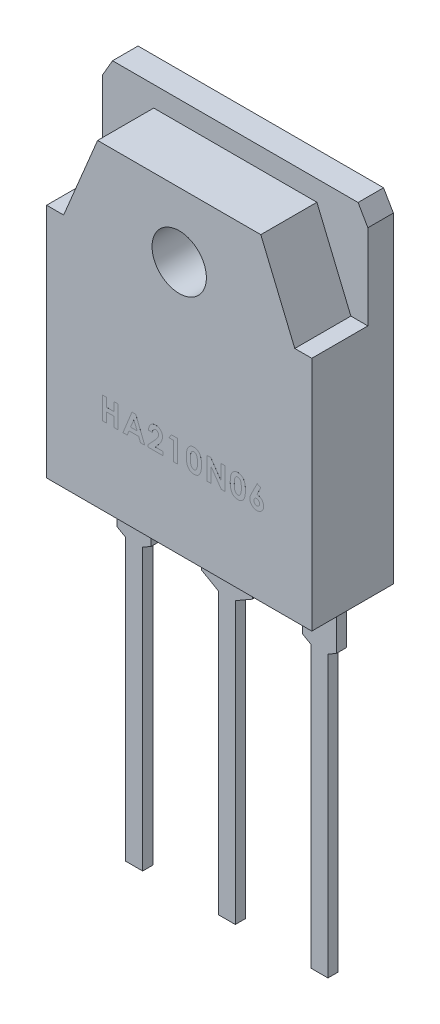
from build123d import *
from OCP.BRepFilletAPI import BRepFilletAPI_MakeChamfer

# Parameters (mm, degrees)
SKETCH1_W                  = 15.6
SKETCH1_H                  = 19.9
MAIN_BODY_DEPTH            = 1.5
FRONT_BODY_DEPTH           = 3.3
FRONT_BODY_DEPTH_BACK      = 1.5
SKETCH3_W                  = 15.6
SKETCH3_H                  = 13.9
SKETCH5_W                  = 2
SKETCH5_H                  = 0.6
LEG_BASE_DEPTH             = 3.5
SKETCH6_W                  = 1
SKETCH6_H                  = 0.6
BASE_DEPTH                 = 16.5
TOP_BODY_DEPTH             = 3.3
F_3_2_3_2_DIAMETER_HOLE1_D = 3.2
PN_DEPTH                   = 0.001
LPATTERN1_COUNT            = 2
LPATTERN1_PITCH            = 5.45
LPATTERN1_COL_COUNT        = 2
LPATTERN1_COL_PITCH        = 5.45
SKETCH14_W                 = 3
SKETCH14_H                 = 3.5
BOSS_EXTRUDE10_DEPTH       = 0.6
CHAMFER1_SIZE              = 0.288675135
CHAMFER1_SIZE_2            = 0.5
CHAMFER2_SIZE              = 0.577350269
CHAMFER2_SIZE_2            = 1
CHAMFER3_SIZE              = 1
CHAMFER3_SIZE2             = 0.577350269


with BuildPart() as part:
    # Sketch1 → MAIN BODY (new body)
    with BuildSketch(Plane.XY):
        with Locations((7.8, 9.95)):
            Rectangle(SKETCH1_W, SKETCH1_H)
    extrude(amount=MAIN_BODY_DEPTH)

    # Sketch3 → FRONT BODY (add, two sides: drawn at the far end of the back side and taken through both)
    with BuildSketch(Plane.XY.offset(1.5).offset(-FRONT_BODY_DEPTH_BACK)):
        with Locations((7.8, 6.95)):
            Rectangle(SKETCH3_W, SKETCH3_H)
    extrude(amount=FRONT_BODY_DEPTH + FRONT_BODY_DEPTH_BACK)

    # Sketch5 → LEG BASE (add)
    with BuildSketch(Plane.XZ):
        with Locations((7.8, 1.7)):
            Rectangle(SKETCH5_W, SKETCH5_H)
    leg_base = extrude(amount=LEG_BASE_DEPTH)

    # Sketch6 → BASE (add)
    with BuildSketch(Plane.XZ.offset(3.5)):
        with Locations((7.8, 1.7)):
            Rectangle(SKETCH6_W, SKETCH6_H)
    base = extrude(amount=BASE_DEPTH)

    # Sketch11 → TOP BODY (add)
    with BuildSketch(Plane.XY.offset(1.5)):
        Polygon((1, 13.9), (3, 18.7), (12.6, 18.7), (14.6, 13.9), align=None)
    extrude(amount=TOP_BODY_DEPTH)

    # Ø3.2 (3.2) Diameter Hole1 (through all)
    with Locations(Plane.XY.offset(4.8)):
        with Locations((7.8, 14.9)):
            Hole(F_3_2_3_2_DIAMETER_HOLE1_D / 2)

    # Sketch10 → PN (add)
    # profile 1 of 8: a face of its own
    with BuildSketch(Plane.XY.offset(4.8)):
        Polygon((3.277142395, 5.873107542), (3.5130431, 5.873107542), (3.5130431, 5.367606031), (3.96799446, 5.367606031), (3.96799446, 5.873107542), (4.203895165, 5.873107542), (4.203895165, 4.558803614), (3.96799446, 4.558803614), (3.96799446, 5.131705326), (3.5130431, 5.131705326), (3.5130431, 4.558803614), (3.277142395, 4.558803614), align=None)
    # profile 2 of 8: a face of its own
    with BuildSketch(Plane.XY.offset(4.8)):
        Polygon((5.023070895, 5.873107542), (5.241858267, 5.873107542), (5.772634854, 4.558803614), (5.520673944, 4.558803614), (5.418520514, 4.82840442), (4.845882084, 4.82840442), (4.743728654, 4.558803614), (4.492031026, 4.558803614), align=None)
        Polygon((5.13233294, 5.520572895), (4.935397976, 5.064305125), (5.329267903, 5.064305125), align=None, mode=Mode.SUBTRACT)
    # profile 3 of 8: a face of its own
    with BuildSketch(Plane.XY.offset(4.8)):
        with BuildLine():
            Line((6.229271218, 5.435006233), (5.993370513, 5.435006233))
            add(Edge.make_bspline(
                [(5.993370513, 5.435006233), (5.994389332, 5.452850873), (5.996380043, 5.487718229), (6.004298589, 5.53836418), (6.014909168, 5.586219034), (6.029070395, 5.63111539), (6.046864903, 5.673036934), (6.067834793, 5.712126579), (6.0925158, 5.748178518), (6.120382629, 5.781018886), (6.150962178, 5.810480284), (6.183619587, 5.836602609), (6.218854395, 5.858158095), (6.256022831, 5.875896265), (6.295118569, 5.890068238), (6.336511513, 5.899543349), (6.379843263, 5.905959986), (6.409507355, 5.906521468), (6.42462649, 5.906807643)],
                knots=[0, 0, 0, 0, 1.199038563, 2.342849363, 3.436047546, 4.486744587, 5.497670872, 6.488682221, 7.459191391, 8.424610317, 9.374430501, 10.305433194, 11.225809216, 12.140057399, 13.06607119, 14.010487599, 14.985989317, 16, 16, 16, 16], degree=3))
            add(Edge.make_bspline(
                [(6.42462649, 5.906807643), (6.443185013, 5.906228568), (6.479415599, 5.905098078), (6.532061516, 5.895454625), (6.581227045, 5.879324459), (6.626876449, 5.856786363), (6.668621107, 5.828154075), (6.706454095, 5.794014758), (6.739231285, 5.75365215), (6.767160492, 5.708745675), (6.790366325, 5.661196037), (6.806628007, 5.61202774), (6.817316635, 5.562545511), (6.818456643, 5.529226683), (6.819022981, 5.512674434)],
                knots=[0, 0, 0, 0, 1.075374347, 2.099382735, 3.09057751, 4.06680945, 5.040638231, 6.016817125, 7.011024321, 8.044445721, 9.0776792, 10.070479129, 11.0414456, 12, 12, 12, 12], degree=3))
            add(Edge.make_bspline(
                [(6.819022981, 5.512674434), (6.818802479, 5.502662464), (6.818358663, 5.482510841), (6.815272752, 5.45201649), (6.810643276, 5.420954429), (6.803663155, 5.389351289), (6.794958371, 5.357198213), (6.78439821, 5.324398977), (6.771737718, 5.291139541), (6.757188174, 5.257045575), (6.739830531, 5.22200639), (6.719619969, 5.185496734), (6.696020053, 5.147548996), (6.66931584, 5.107948908), (6.639377635, 5.066758928), (6.60605929, 5.024103131), (6.569744552, 4.979831213), (6.543970961, 4.950237921), (6.53072915, 4.935033645)],
                knots=[0, 0, 0, 0, 0.728284026, 1.46585585, 2.227944881, 3.01186502, 3.81876927, 4.650621989, 5.517437689, 6.406905708, 7.346299482, 8.360816762, 9.441613733, 10.596154504, 11.834900912, 13.145207542, 14.533280747, 16, 16, 16, 16], degree=3))
            Line((6.53072915, 4.935033645), (6.393559209, 4.777854269))
            Line((6.393559209, 4.777854269), (6.835873031, 4.777854269))
            Line((6.835873031, 4.777854269), (6.835873031, 4.558803614))
            Line((6.835873031, 4.558803614), (5.959670412, 4.558803614))
            Line((5.959670412, 4.558803614), (5.959670412, 4.678333659))
            Line((5.959670412, 4.678333659), (6.348801263, 5.092476303))
            add(Edge.make_bspline(
                [(6.348801263, 5.092476303), (6.360067601, 5.104556972), (6.381887157, 5.127953647), (6.412934136, 5.162314152), (6.44102891, 5.194921451), (6.46558891, 5.226122747), (6.487903014, 5.254905995), (6.506976237, 5.282138759), (6.522983085, 5.307574846), (6.540360789, 5.338246323), (6.556863895, 5.374827518), (6.572006493, 5.416970555), (6.581236955, 5.457249593), (6.582511051, 5.483496279), (6.583122276, 5.496087665)],
                knots=[0, 0, 0, 0, 1.246127091, 2.413378631, 3.493388633, 4.492180848, 5.408488754, 6.240484944, 6.999099869, 7.674939598, 8.898438119, 10.020720584, 11.050475521, 12, 12, 12, 12], degree=3))
            add(Edge.make_bspline(
                [(6.583122276, 5.496087665), (6.582665278, 5.50826886), (6.58177977, 5.531871878), (6.572048764, 5.565447044), (6.556973152, 5.595845931), (6.535729485, 5.622160183), (6.509996752, 5.643784349), (6.48026016, 5.659867797), (6.446762153, 5.669147872), (6.423279411, 5.670309406), (6.411199106, 5.670906938)],
                knots=[0, 0, 0, 0, 1.062038974, 2.057870785, 3.028805853, 4.01125022, 4.991535629, 5.949134679, 6.94496649, 8, 8, 8, 8], degree=3))
            add(Edge.make_bspline(
                [(6.411199106, 5.670906938), (6.404958266, 5.670686202), (6.392672171, 5.670251649), (6.374612572, 5.667358947), (6.357427565, 5.662260861), (6.340925873, 5.655430144), (6.325283606, 5.646375979), (6.310540219, 5.635215279), (6.29654037, 5.622231661), (6.283348271, 5.607465724), (6.271341737, 5.590986934), (6.260677579, 5.572945792), (6.251860095, 5.553353495), (6.244096861, 5.532468692), (6.238109484, 5.510067063), (6.233749931, 5.486282679), (6.230435653, 5.461154235), (6.229666424, 5.443880793), (6.229271218, 5.435006233)],
                knots=[0, 0, 0, 0, 0.903469896, 1.778625579, 2.63899355, 3.493148037, 4.358286772, 5.247621495, 6.164656832, 7.118446693, 8.109501108, 9.111810964, 10.146451449, 11.215617525, 12.33435995, 13.498009769, 14.714554818, 16, 16, 16, 16], degree=3))
        make_face()
    # profile 4 of 8: a face of its own
    with BuildSketch(Plane.XY.offset(4.8)):
        Polygon((7.340690009, 5.873107542), (7.70533563, 5.873107542), (7.70533563, 4.558803614), (7.469434925, 4.558803614), (7.469434925, 5.654056887), (7.199834119, 5.654056887), align=None)
    # profile 5 of 8: a face of its own
    with BuildSketch(Plane.XY.offset(4.8)):
        with BuildLine():
            add(Edge.make_bspline(
                [(8.663524275, 5.906807643), (8.674942848, 5.906638131), (8.697394814, 5.906304825), (8.730462333, 5.902694852), (8.762315497, 5.89724119), (8.793078918, 5.889635233), (8.82253116, 5.87956902), (8.85088658, 5.867519935), (8.877807668, 5.852855979), (8.903637754, 5.836292289), (8.928366887, 5.817539842), (8.951400721, 5.796161086), (8.973159902, 5.772647944), (8.993173423, 5.746644941), (9.011884492, 5.718388602), (9.029231625, 5.687874447), (9.045082026, 5.654953128), (9.059613342, 5.619565237), (9.07260729, 5.581180324), (9.083552076, 5.539358098), (9.092939061, 5.494089008), (9.10086234, 5.445260373), (9.106851057, 5.392807287), (9.110887574, 5.336764598), (9.113657622, 5.277240348), (9.113883694, 5.236407201), (9.11399984, 5.215429014)],
                knots=[0, 0, 0, 0, 0.879237366, 1.728815576, 2.559023295, 3.367336655, 4.166867292, 4.954216142, 5.737608147, 6.525189134, 7.316157332, 8.124696809, 8.942788509, 9.781158001, 10.649253743, 11.551476218, 12.482711956, 13.461909668, 14.496590415, 15.601789533, 16.789733467, 18.056700938, 19.410929216, 20.8549011, 22.384193279, 24, 24, 24, 24], degree=3))
            add(Edge.make_bspline(
                [(9.11399984, 5.215429014), (9.113874318, 5.194188366), (9.113630431, 5.152918169), (9.111002725, 5.092849479), (9.106477692, 5.036399887), (9.100645502, 4.983575231), (9.092656997, 4.934403408), (9.083301347, 4.888757095), (9.0721838, 4.846652839), (9.058761836, 4.808185509), (9.044318479, 4.772735469), (9.02842472, 4.739878338), (9.011357584, 4.709525123), (8.993508541, 4.681217902), (8.973899039, 4.65579116), (8.953483529, 4.632380252), (8.931373083, 4.611876932), (8.908498637, 4.593224549), (8.884022206, 4.577105147), (8.85819621, 4.563007384), (8.830560216, 4.551572423), (8.801617981, 4.541626905), (8.770876179, 4.534487097), (8.738823293, 4.528821893), (8.705097452, 4.525690954), (8.682135541, 4.525302541), (8.670369607, 4.525103513)],
                knots=[0, 0, 0, 0, 1.643780988, 3.193836972, 4.651895693, 6.025988579, 7.305620092, 8.505800249, 9.631074763, 10.672816429, 11.65661981, 12.592235626, 13.49536222, 14.350718032, 15.179365177, 15.97804903, 16.751647189, 17.51006938, 18.259804725, 19.016521909, 19.783502495, 20.571750527, 21.382245291, 22.22305063, 23.089471752, 24, 24, 24, 24], degree=3))
            add(Edge.make_bspline(
                [(8.670369607, 4.525103513), (8.658603991, 4.52530638), (8.635555323, 4.525703792), (8.601738284, 4.528798613), (8.569515534, 4.534510047), (8.538530515, 4.54168172), (8.508998877, 4.551550418), (8.480779019, 4.563327504), (8.454087926, 4.577337304), (8.428851694, 4.593494263), (8.405156488, 4.612021847), (8.382634083, 4.632721884), (8.361334301, 4.655541904), (8.341581165, 4.68073751), (8.323051174, 4.707972393), (8.305937568, 4.737557563), (8.290250631, 4.769449944), (8.275499674, 4.803693991), (8.262682959, 4.841026939), (8.251276678, 4.881782167), (8.241932952, 4.926299402), (8.234418103, 4.974564344), (8.228418251, 5.026474741), (8.223955052, 5.082055648), (8.22131275, 5.141332954), (8.221071421, 5.182077199), (8.220947171, 5.203054758)],
                knots=[0, 0, 0, 0, 0.917216111, 1.796812873, 2.643793957, 3.46689424, 4.273913431, 5.068098542, 5.848489301, 6.620921603, 7.401012384, 8.190319798, 9.003608147, 9.831726257, 10.68377682, 11.569763213, 12.493818149, 13.453288342, 14.474581811, 15.568529029, 16.750744269, 18.018426408, 19.375425659, 20.823733699, 22.36466933, 24, 24, 24, 24], degree=3))
            add(Edge.make_bspline(
                [(8.220947171, 5.203054758), (8.221172239, 5.232201425), (8.22160651, 5.288440294), (8.227109922, 5.369689108), (8.235187534, 5.444789563), (8.247051632, 5.513616033), (8.261721426, 5.576423432), (8.28050686, 5.632798017), (8.301892711, 5.683519858), (8.320116204, 5.713567782), (8.328892806, 5.72803914)],
                knots=[0, 0, 0, 0, 1.288568992, 2.486310467, 3.599230591, 4.627010532, 5.572937695, 6.447898582, 7.252493626, 8, 8, 8, 8], degree=3))
            add(Edge.make_bspline(
                [(8.328892806, 5.72803914), (8.339097821, 5.742255797), (8.359050636, 5.770052163), (8.393938691, 5.806543596), (8.431421364, 5.837752856), (8.472268527, 5.86297365), (8.515834165, 5.882862771), (8.562492313, 5.896910233), (8.612070668, 5.905094938), (8.646116952, 5.906228216), (8.663524275, 5.906807643)],
                knots=[0, 0, 0, 0, 1.058512271, 2.069600068, 3.047294572, 4.004278952, 4.967380941, 5.939006123, 6.946246673, 8, 8, 8, 8], degree=3))
        make_face()
        with BuildLine():
            add(Edge.make_bspline(
                [(8.669316479, 5.670906938), (8.658993994, 5.670417672), (8.638756445, 5.669458453), (8.609390795, 5.661316032), (8.581700822, 5.648739623), (8.560637798, 5.633605881), (8.544872335, 5.619098375), (8.533856893, 5.605969554), (8.523234235, 5.591318735), (8.513851768, 5.574484804), (8.50499227, 5.556072622), (8.496333871, 5.53599861), (8.489236257, 5.513769706), (8.482263039, 5.489764472), (8.47615385, 5.463319227), (8.471035688, 5.434217809), (8.466463061, 5.40227097), (8.463273599, 5.367457785), (8.460300063, 5.329814676), (8.458168492, 5.289257789), (8.457277336, 5.245798067), (8.456994064, 5.215868001), (8.456847876, 5.200421938)],
                knots=[0, 0, 0, 0, 1.076674018, 2.110852608, 3.161083442, 4.239746716, 4.804137807, 5.395870207, 6.026861976, 6.692161227, 7.405688833, 8.16177676, 8.973626916, 9.841385931, 10.773283133, 11.807421078, 12.927755683, 14.143907515, 15.458935494, 16.872852025, 18.386167141, 20, 20, 20, 20], degree=3))
            add(Edge.make_bspline(
                [(8.456847876, 5.200421938), (8.457088484, 5.180410817), (8.457549869, 5.142038008), (8.459966385, 5.086856574), (8.464810092, 5.036637025), (8.470834685, 4.991039006), (8.479296472, 4.950358231), (8.489032305, 4.914209823), (8.501055194, 4.883054586), (8.514949959, 4.856441946), (8.530339037, 4.833802628), (8.547044558, 4.814559106), (8.56449776, 4.797895123), (8.583243412, 4.784359176), (8.603236794, 4.77398585), (8.624310998, 4.766524444), (8.646479415, 4.761957007), (8.661660119, 4.761323651), (8.669316479, 4.761004218)],
                knots=[0, 0, 0, 0, 1.771748488, 3.397459088, 4.888034009, 6.237357457, 7.467047327, 8.564189669, 9.548206622, 10.417051504, 11.216568818, 11.965764335, 12.669334354, 13.348544111, 14.005342236, 14.656555988, 15.322436492, 16, 16, 16, 16], degree=3))
            add(Edge.make_bspline(
                [(8.669316479, 4.761004218), (8.676710097, 4.761222798), (8.691185882, 4.761650749), (8.712294818, 4.766043609), (8.732256928, 4.773185446), (8.75101194, 4.783288075), (8.768626938, 4.796135114), (8.78501583, 4.811783018), (8.800055016, 4.83038776), (8.808816914, 4.84419523), (8.813331753, 4.851309957)],
                knots=[0, 0, 0, 0, 0.992283464, 1.942767638, 2.88273346, 3.832339453, 4.79467288, 5.803907806, 6.868395428, 8, 8, 8, 8], degree=3))
            add(Edge.make_bspline(
                [(8.813331753, 4.851309957), (8.818647217, 4.861032004), (8.829793312, 4.881418348), (8.842691592, 4.915819544), (8.853548646, 4.954618407), (8.862893153, 4.997935682), (8.869284226, 5.04594222), (8.87478821, 5.098333606), (8.877442918, 5.155373662), (8.877874721, 5.194891218), (8.878099135, 5.215429014)],
                knots=[0, 0, 0, 0, 0.710965849, 1.490837728, 2.352621235, 3.297892224, 4.334225155, 5.461620853, 6.680770821, 8, 8, 8, 8], degree=3))
            add(Edge.make_bspline(
                [(8.878099135, 5.215429014), (8.878012448, 5.236145088), (8.877845592, 5.276019994), (8.874784268, 5.333265113), (8.87052114, 5.385549028), (8.864285414, 5.432755011), (8.85626202, 5.474997658), (8.846373156, 5.512274206), (8.834714921, 5.544658121), (8.820889643, 5.572117112), (8.805577289, 5.595453487), (8.789322758, 5.615474287), (8.772057319, 5.63256754), (8.753809846, 5.646797573), (8.734157994, 5.657670385), (8.713477139, 5.66534749), (8.691724884, 5.669991881), (8.676886766, 5.670597802), (8.669316479, 5.670906938)],
                knots=[0, 0, 0, 0, 1.793836731, 3.452829483, 4.963243077, 6.335886805, 7.574563692, 8.684454726, 9.672768357, 10.54971625, 11.340229787, 12.085688095, 12.778991901, 13.440269426, 14.083255152, 14.715733572, 15.344777694, 16, 16, 16, 16], degree=3))
        make_face(mode=Mode.SUBTRACT)
    # profile 6 of 8: a face of its own
    with BuildSketch(Plane.XY.offset(4.8)):
        Polygon((9.444260827, 5.873107542), (9.65672943, 5.873107542), (10.253063244, 5.008226051), (10.253063244, 5.873107542), (10.488963949, 5.873107542), (10.488963949, 4.558803614), (10.274915653, 4.558803614), (9.680161532, 5.421052285), (9.680161532, 4.558803614), (9.444260827, 4.558803614), align=None)
    # profile 7 of 8: a face of its own
    with BuildSketch(Plane.XY.offset(4.8)):
        with BuildLine():
            add(Edge.make_bspline(
                [(11.244951989, 5.906807643), (11.256370563, 5.906638131), (11.278822528, 5.906304825), (11.311890048, 5.902694852), (11.343743212, 5.89724119), (11.374506633, 5.889635233), (11.403958874, 5.87956902), (11.432314295, 5.867519935), (11.459235383, 5.852855979), (11.485065469, 5.836292289), (11.509794602, 5.817539842), (11.532828436, 5.796161086), (11.554587617, 5.772647944), (11.574601138, 5.746644941), (11.593312206, 5.718388602), (11.61065934, 5.687874447), (11.626509741, 5.654953128), (11.641041056, 5.619565237), (11.654035004, 5.581180324), (11.664979791, 5.539358098), (11.674366776, 5.494089008), (11.682290054, 5.445260373), (11.688278772, 5.392807287), (11.692315288, 5.336764598), (11.695085337, 5.277240348), (11.695311409, 5.236407201), (11.695427554, 5.215429014)],
                knots=[0, 0, 0, 0, 0.879237366, 1.728815576, 2.559023295, 3.367336655, 4.166867292, 4.954216142, 5.737608147, 6.525189134, 7.316157332, 8.124696809, 8.942788509, 9.781158001, 10.649253743, 11.551476218, 12.482711956, 13.461909668, 14.496590415, 15.601789533, 16.789733467, 18.056700938, 19.410929216, 20.8549011, 22.384193279, 24, 24, 24, 24], degree=3))
            add(Edge.make_bspline(
                [(11.695427554, 5.215429014), (11.695302033, 5.194188366), (11.695058146, 5.152918169), (11.69243044, 5.092849479), (11.687905406, 5.036399887), (11.682073216, 4.983575231), (11.674084711, 4.934403408), (11.664729062, 4.888757095), (11.653611515, 4.846652839), (11.640189551, 4.808185509), (11.625746194, 4.772735469), (11.609852435, 4.739878338), (11.592785299, 4.709525123), (11.574936255, 4.681217902), (11.555326754, 4.65579116), (11.534911244, 4.632380252), (11.512800798, 4.611876932), (11.489926352, 4.593224549), (11.465449921, 4.577105147), (11.439623925, 4.563007384), (11.411987931, 4.551572423), (11.383045696, 4.541626905), (11.352303894, 4.534487097), (11.320251008, 4.528821893), (11.286525167, 4.525690954), (11.263563256, 4.525302541), (11.251797322, 4.525103513)],
                knots=[0, 0, 0, 0, 1.643780988, 3.193836972, 4.651895693, 6.025988579, 7.305620092, 8.505800249, 9.631074763, 10.672816429, 11.65661981, 12.592235626, 13.49536222, 14.350718032, 15.179365177, 15.97804903, 16.751647189, 17.51006938, 18.259804725, 19.016521909, 19.783502495, 20.571750527, 21.382245291, 22.22305063, 23.089471752, 24, 24, 24, 24], degree=3))
            add(Edge.make_bspline(
                [(11.251797322, 4.525103513), (11.240031706, 4.52530638), (11.216983037, 4.525703792), (11.183165999, 4.528798613), (11.150943248, 4.534510047), (11.119958229, 4.54168172), (11.090426592, 4.551550418), (11.062206734, 4.563327504), (11.035515641, 4.577337304), (11.010279409, 4.593494263), (10.986584203, 4.612021847), (10.964061798, 4.632721884), (10.942762016, 4.655541904), (10.92300888, 4.68073751), (10.904478889, 4.707972393), (10.887365283, 4.737557563), (10.871678346, 4.769449944), (10.856927389, 4.803693991), (10.844110674, 4.841026939), (10.832704393, 4.881782167), (10.823360667, 4.926299402), (10.815845818, 4.974564344), (10.809845966, 5.026474741), (10.805382766, 5.082055648), (10.802740465, 5.141332954), (10.802499136, 5.182077199), (10.802374885, 5.203054758)],
                knots=[0, 0, 0, 0, 0.917216111, 1.796812873, 2.643793957, 3.46689424, 4.273913431, 5.068098542, 5.848489301, 6.620921603, 7.401012384, 8.190319798, 9.003608147, 9.831726257, 10.68377682, 11.569763213, 12.493818149, 13.453288342, 14.474581811, 15.568529029, 16.750744269, 18.018426408, 19.375425659, 20.823733699, 22.36466933, 24, 24, 24, 24], degree=3))
            add(Edge.make_bspline(
                [(10.802374885, 5.203054758), (10.802599954, 5.232201425), (10.803034225, 5.288440294), (10.808537637, 5.369689108), (10.816615249, 5.444789563), (10.828479347, 5.513616033), (10.843149141, 5.576423432), (10.861934575, 5.632798017), (10.883320426, 5.683519858), (10.901543918, 5.713567782), (10.910320521, 5.72803914)],
                knots=[0, 0, 0, 0, 1.288568992, 2.486310467, 3.599230591, 4.627010532, 5.572937695, 6.447898582, 7.252493626, 8, 8, 8, 8], degree=3))
            add(Edge.make_bspline(
                [(10.910320521, 5.72803914), (10.920525536, 5.742255797), (10.940478351, 5.770052163), (10.975366406, 5.806543596), (11.012849078, 5.837752856), (11.053696242, 5.86297365), (11.09726188, 5.882862771), (11.143920028, 5.896910233), (11.193498383, 5.905094938), (11.227544667, 5.906228216), (11.244951989, 5.906807643)],
                knots=[0, 0, 0, 0, 1.058512271, 2.069600068, 3.047294572, 4.004278952, 4.967380941, 5.939006123, 6.946246673, 8, 8, 8, 8], degree=3))
        make_face()
        with BuildLine():
            add(Edge.make_bspline(
                [(11.250744194, 5.670906938), (11.240421709, 5.670417672), (11.220184159, 5.669458453), (11.19081851, 5.661316032), (11.163128537, 5.648739623), (11.142065513, 5.633605881), (11.12630005, 5.619098375), (11.115284607, 5.605969554), (11.104661949, 5.591318735), (11.095279483, 5.574484804), (11.086419985, 5.556072622), (11.077761586, 5.53599861), (11.070663972, 5.513769706), (11.063690754, 5.489764472), (11.057581565, 5.463319227), (11.052463403, 5.434217809), (11.047890776, 5.40227097), (11.044701314, 5.367457785), (11.041727778, 5.329814676), (11.039596207, 5.289257789), (11.03870505, 5.245798067), (11.038421779, 5.215868001), (11.03827559, 5.200421938)],
                knots=[0, 0, 0, 0, 1.076674018, 2.110852608, 3.161083442, 4.239746716, 4.804137807, 5.395870207, 6.026861976, 6.692161227, 7.405688833, 8.16177676, 8.973626916, 9.841385931, 10.773283133, 11.807421078, 12.927755683, 14.143907515, 15.458935494, 16.872852025, 18.386167141, 20, 20, 20, 20], degree=3))
            add(Edge.make_bspline(
                [(11.03827559, 5.200421938), (11.038516199, 5.180410817), (11.038977583, 5.142038008), (11.0413941, 5.086856574), (11.046237807, 5.036637025), (11.0522624, 4.991039006), (11.060724187, 4.950358231), (11.07046002, 4.914209823), (11.082482909, 4.883054586), (11.096377674, 4.856441946), (11.111766752, 4.833802628), (11.128472273, 4.814559106), (11.145925474, 4.797895123), (11.164671127, 4.784359176), (11.184664509, 4.77398585), (11.205738713, 4.766524444), (11.22790713, 4.761957007), (11.243087834, 4.761323651), (11.250744194, 4.761004218)],
                knots=[0, 0, 0, 0, 1.771748488, 3.397459088, 4.888034009, 6.237357457, 7.467047327, 8.564189669, 9.548206622, 10.417051504, 11.216568818, 11.965764335, 12.669334354, 13.348544111, 14.005342236, 14.656555988, 15.322436492, 16, 16, 16, 16], degree=3))
            add(Edge.make_bspline(
                [(11.250744194, 4.761004218), (11.258137812, 4.761222798), (11.272613597, 4.761650749), (11.293722533, 4.766043609), (11.313684643, 4.773185446), (11.332439655, 4.783288075), (11.350054653, 4.796135114), (11.366443545, 4.811783018), (11.381482731, 4.83038776), (11.390244629, 4.84419523), (11.394759468, 4.851309957)],
                knots=[0, 0, 0, 0, 0.992283464, 1.942767638, 2.88273346, 3.832339453, 4.79467288, 5.803907806, 6.868395428, 8, 8, 8, 8], degree=3))
            add(Edge.make_bspline(
                [(11.394759468, 4.851309957), (11.400074931, 4.861032004), (11.411221026, 4.881418348), (11.424119307, 4.915819544), (11.43497636, 4.954618407), (11.444320868, 4.997935682), (11.450711941, 5.04594222), (11.456215925, 5.098333606), (11.458870633, 5.155373662), (11.459302436, 5.194891218), (11.459526849, 5.215429014)],
                knots=[0, 0, 0, 0, 0.710965849, 1.490837728, 2.352621235, 3.297892224, 4.334225155, 5.461620853, 6.680770821, 8, 8, 8, 8], degree=3))
            add(Edge.make_bspline(
                [(11.459526849, 5.215429014), (11.459440163, 5.236145088), (11.459273307, 5.276019994), (11.456211983, 5.333265113), (11.451948855, 5.385549028), (11.445713129, 5.432755011), (11.437689735, 5.474997658), (11.427800871, 5.512274206), (11.416142635, 5.544658121), (11.402317358, 5.572117112), (11.387005004, 5.595453487), (11.370750473, 5.615474287), (11.353485034, 5.63256754), (11.335237561, 5.646797573), (11.315585708, 5.657670385), (11.294904854, 5.66534749), (11.273152599, 5.669991881), (11.258314481, 5.670597802), (11.250744194, 5.670906938)],
                knots=[0, 0, 0, 0, 1.793836731, 3.452829483, 4.963243077, 6.335886805, 7.574563692, 8.684454726, 9.672768357, 10.54971625, 11.340229787, 12.085688095, 12.778991901, 13.440269426, 14.083255152, 14.715733572, 15.344777694, 16, 16, 16, 16], degree=3))
        make_face(mode=Mode.SUBTRACT)
    # profile 8 of 8: a face of its own
    with BuildSketch(Plane.XY.offset(4.8)):
        with BuildLine():
            Line((12.391124009, 5.906807643), (12.599906664, 5.800968264))
            Line((12.599906664, 5.800968264), (12.370851292, 5.350755981))
            add(Edge.make_bspline(
                [(12.370851292, 5.350755981), (12.384383668, 5.350405621), (12.411037903, 5.349715529), (12.450254201, 5.344138094), (12.487745712, 5.334496045), (12.52389046, 5.321715536), (12.558246612, 5.304551185), (12.591367492, 5.284133294), (12.622396245, 5.259231479), (12.652044335, 5.23164159), (12.679003191, 5.201075958), (12.702421724, 5.168232216), (12.722830562, 5.133909455), (12.738695571, 5.097339793), (12.751492815, 5.059129412), (12.760726591, 5.019125571), (12.765994718, 4.977212425), (12.766721017, 4.948738927), (12.767090757, 4.934243799)],
                knots=[0, 0, 0, 0, 1.013260694, 1.995783107, 2.958651975, 3.908806537, 4.861209129, 5.829647963, 6.817170299, 7.835534541, 8.860094905, 9.863329007, 10.853101798, 11.844815043, 12.84250023, 13.867713965, 14.914507806, 16, 16, 16, 16], degree=3))
            add(Edge.make_bspline(
                [(12.767090757, 4.934243799), (12.76674428, 4.920271374), (12.766059443, 4.892653882), (12.760398359, 4.852090811), (12.751249749, 4.813172916), (12.738174549, 4.775977921), (12.721554912, 4.740324017), (12.701230221, 4.706232124), (12.677031924, 4.673957002), (12.649585236, 4.643670144), (12.619581271, 4.616063449), (12.587955458, 4.591525012), (12.554439804, 4.571255332), (12.519667793, 4.554137112), (12.482999252, 4.541363211), (12.444982928, 4.531721129), (12.40533053, 4.526157229), (12.378415499, 4.525457563), (12.364795805, 4.525103513)],
                knots=[0, 0, 0, 0, 1.049934834, 2.075270938, 3.072134561, 4.05064612, 5.033440221, 6.024524368, 7.028587226, 8.060776465, 9.092543989, 10.090062252, 11.064205434, 12.031961459, 12.998029633, 13.977230324, 14.976426867, 16, 16, 16, 16], degree=3))
            add(Edge.make_bspline(
                [(12.364795805, 4.525103513), (12.350553744, 4.525394063), (12.322548659, 4.525965389), (12.281570211, 4.532362736), (12.242268352, 4.541993049), (12.204863965, 4.555743501), (12.169124444, 4.573252093), (12.135470558, 4.594917215), (12.103618817, 4.620499959), (12.07390881, 4.649424752), (12.047142308, 4.681107905), (12.023268824, 4.714003267), (12.003071827, 4.748162459), (11.986722828, 4.783548956), (11.97396696, 4.820049998), (11.965091478, 4.857734863), (11.959308282, 4.896503589), (11.958630334, 4.922814241), (11.95828834, 4.936086773)],
                knots=[0, 0, 0, 0, 1.063775006, 2.091769615, 3.092589432, 4.084662827, 5.064601646, 6.061867366, 7.070035304, 8.113879863, 9.156342271, 10.166834137, 11.149076039, 12.117706134, 13.076241869, 14.034148791, 15.008317125, 16, 16, 16, 16], degree=3))
            add(Edge.make_bspline(
                [(11.95828834, 4.936086773), (11.958469043, 4.946364796), (11.958831455, 4.966978054), (11.962473475, 4.997845288), (11.968010625, 5.028793546), (11.974428907, 5.054908666), (11.981037805, 5.076991732), (11.987689712, 5.095680035), (11.995933285, 5.116419965), (12.00535691, 5.139264483), (12.016256926, 5.164186107), (12.028576393, 5.191116908), (12.042345981, 5.220260825), (12.052165593, 5.240278184), (12.057282386, 5.250708807)],
                knots=[0, 0, 0, 0, 1.110454016, 2.227089276, 3.35462975, 4.507227546, 5.131400587, 5.845402449, 6.650387134, 7.543487832, 8.516250726, 9.590168902, 10.744287919, 12, 12, 12, 12], degree=3))
            Line((12.057282386, 5.250708807), (12.391124009, 5.906807643))
        make_face()
        with BuildLine():
            add(Edge.make_bspline(
                [(12.359530164, 5.131705326), (12.34821093, 5.131186137), (12.326060676, 5.130170152), (12.294566326, 5.119530258), (12.265850625, 5.102838913), (12.2409595, 5.079592987), (12.220140364, 5.051813193), (12.204841733, 5.020126628), (12.195638756, 4.984956139), (12.194682625, 4.960365519), (12.194189045, 4.947671183)],
                knots=[0, 0, 0, 0, 0.981744412, 1.921144944, 2.858899012, 3.85339082, 4.86292663, 5.863643845, 6.897155691, 8, 8, 8, 8], degree=3))
            add(Edge.make_bspline(
                [(12.194189045, 4.947671183), (12.194773459, 4.934972618), (12.195910184, 4.910273062), (12.205459205, 4.874767688), (12.221093916, 4.842361557), (12.2430206, 4.81421362), (12.268762212, 4.790848653), (12.297306607, 4.773569143), (12.328177653, 4.762953773), (12.34953191, 4.761658557), (12.36032001, 4.761004218)],
                knots=[0, 0, 0, 0, 1.098279937, 2.136227893, 3.159405121, 4.194678092, 5.206500211, 6.154139736, 7.067477469, 8, 8, 8, 8], degree=3))
            add(Edge.make_bspline(
                [(12.36032001, 4.761004218), (12.371713464, 4.761670211), (12.394058004, 4.76297634), (12.426291469, 4.773145034), (12.455736933, 4.790135056), (12.481772419, 4.813425218), (12.504136407, 4.841251949), (12.519610027, 4.873848428), (12.529600504, 4.909610068), (12.530648323, 4.934699691), (12.531190052, 4.947671183)],
                knots=[0, 0, 0, 0, 0.96921794, 1.900804717, 2.848419905, 3.844199796, 4.861108892, 5.867439427, 6.897452859, 8, 8, 8, 8], degree=3))
            add(Edge.make_bspline(
                [(12.531190052, 4.947671183), (12.530572924, 4.960358107), (12.529377782, 4.984927819), (12.520400853, 5.020263073), (12.504373153, 5.051827507), (12.483082967, 5.079707658), (12.457335222, 5.102943218), (12.42747026, 5.119661891), (12.394537196, 5.130151301), (12.37136931, 5.131179765), (12.359530164, 5.131705326)],
                knots=[0, 0, 0, 0, 1.083229974, 2.097801324, 3.086792542, 4.086858909, 5.079819718, 6.026392613, 6.991456328, 8, 8, 8, 8], degree=3))
        make_face(mode=Mode.SUBTRACT)
    extrude(amount=PN_DEPTH)

    # LPattern1: LEG BASE, BASE ×2
    with Locations(*[(i * LPATTERN1_PITCH, 0, 0) for i in range(1, LPATTERN1_COUNT)]):
        add(leg_base)
        add(base)

    # LPattern1 col: LEG BASE, BASE ×2
    with Locations(*[(-i * LPATTERN1_COL_PITCH, 0, 0) for i in range(1, LPATTERN1_COL_COUNT)]):
        add(leg_base)
        add(base)

    # Sketch14 → Boss-Extrude10 (add)
    with BuildSketch(Plane.XY.offset(2)):
        with Locations((7.8, -1.75)):
            Rectangle(SKETCH14_W, SKETCH14_H)
    extrude(amount=-BOSS_EXTRUDE10_DEPTH)

    # Chamfer1
    chamfer1_edges_1 = [part.edges().sort_by_distance(p)[0] for p in [
        (14.25, -3.5, 1.7),
    ]]
    chamfer1_side_1 = [part.faces().sort_by_distance(p)[0] for p in [
        (14.25, -3.494226497, 1.7),
    ]]
    chamfer1_edges_2 = [part.edges().sort_by_distance(p)[0] for p in [
        (12.25, -3.5, 1.7),
    ]]
    chamfer1_side_2 = [part.faces().sort_by_distance(p)[0] for p in [
        (12.255773503, -3.5, 1.7),
    ]]
    chamfer1_edges_3 = [part.edges().sort_by_distance(p)[0] for p in [
        (3.35, -3.5, 1.7),
    ]]
    chamfer1_side_3 = [part.faces().sort_by_distance(p)[0] for p in [
        (3.35, -3.494226497, 1.7),
    ]]
    chamfer1_edges_4 = [part.edges().sort_by_distance(p)[0] for p in [
        (1.35, -3.5, 1.7),
    ]]
    chamfer1_side_4 = [part.faces().sort_by_distance(p)[0] for p in [
        (1.355773503, -3.5, 1.7),
    ]]
    chamfer1 = BRepFilletAPI_MakeChamfer(part.part.solid().wrapped)
    for e in chamfer1_edges_1:
        chamfer1.Add(CHAMFER1_SIZE - 0.0001, CHAMFER1_SIZE_2 - 0.0001, e.wrapped, chamfer1_side_1[0].wrapped)
    for e in chamfer1_edges_2:
        chamfer1.Add(CHAMFER1_SIZE_2 - 0.0001, CHAMFER1_SIZE - 0.0001, e.wrapped, chamfer1_side_2[0].wrapped)
    for e in chamfer1_edges_3:
        chamfer1.Add(CHAMFER1_SIZE - 0.0001, CHAMFER1_SIZE_2 - 0.0001, e.wrapped, chamfer1_side_3[0].wrapped)
    for e in chamfer1_edges_4:
        chamfer1.Add(CHAMFER1_SIZE_2 - 0.0001, CHAMFER1_SIZE - 0.0001, e.wrapped, chamfer1_side_4[0].wrapped)
    add(Compound.cast(chamfer1.Shape()), mode=Mode.REPLACE)  # a hair under: the kernel refuses the full size

    # Chamfer2
    chamfer2_edges_1 = [part.edges().sort_by_distance(p)[0] for p in [
        (9.3, -3.5, 1.7),
    ]]
    chamfer2_side_1 = [part.faces().sort_by_distance(p)[0] for p in [
        (9.3, -3.488452995, 1.7),
    ]]
    chamfer2_edges_2 = [part.edges().sort_by_distance(p)[0] for p in [
        (6.3, -3.5, 1.7),
    ]]
    chamfer2_side_2 = [part.faces().sort_by_distance(p)[0] for p in [
        (6.3, -3.488452995, 1.7),
    ]]
    chamfer2 = BRepFilletAPI_MakeChamfer(part.part.solid().wrapped)
    for e in chamfer2_edges_1:
        chamfer2.Add(CHAMFER2_SIZE - 0.0001, CHAMFER2_SIZE_2 - 0.0001, e.wrapped, chamfer2_side_1[0].wrapped)
    for e in chamfer2_edges_2:
        chamfer2.Add(CHAMFER2_SIZE - 0.0001, CHAMFER2_SIZE_2 - 0.0001, e.wrapped, chamfer2_side_2[0].wrapped)
    add(Compound.cast(chamfer2.Shape()), mode=Mode.REPLACE)  # a hair under: the kernel refuses the full size

    # Chamfer3: one chamfer whose edges measure the first distance from different faces: ONE call of the kernel's chamfer builder (chamfer() names one face for all edges)
    chamfer3_edges_1 = [part.edges().sort_by_distance(p)[0] for p in [
        (0, 19.9, 0.75),
    ]]
    chamfer3_side_1 = [part.faces().sort_by_distance(p)[0] for p in [
        (0, 8.132646593, 2.203882726),
    ]]
    chamfer3_edges_2 = [part.edges().sort_by_distance(p)[0] for p in [
        (15.6, 19.9, 0.75),
    ]]
    chamfer3_side_2 = [part.faces().sort_by_distance(p)[0] for p in [
        (15.6, 8.132646593, 2.203882726),
    ]]
    chamfer3 = BRepFilletAPI_MakeChamfer(part.part.solid().wrapped)
    for e in chamfer3_edges_1:
        chamfer3.Add(CHAMFER3_SIZE, CHAMFER3_SIZE2, e.wrapped, chamfer3_side_1[0].wrapped)  # the first distance lies on this face
    for e in chamfer3_edges_2:
        chamfer3.Add(CHAMFER3_SIZE, CHAMFER3_SIZE2, e.wrapped, chamfer3_side_2[0].wrapped)  # the first distance lies on this face
    add(Compound.cast(chamfer3.Shape()), mode=Mode.REPLACE)


solid = part.part
